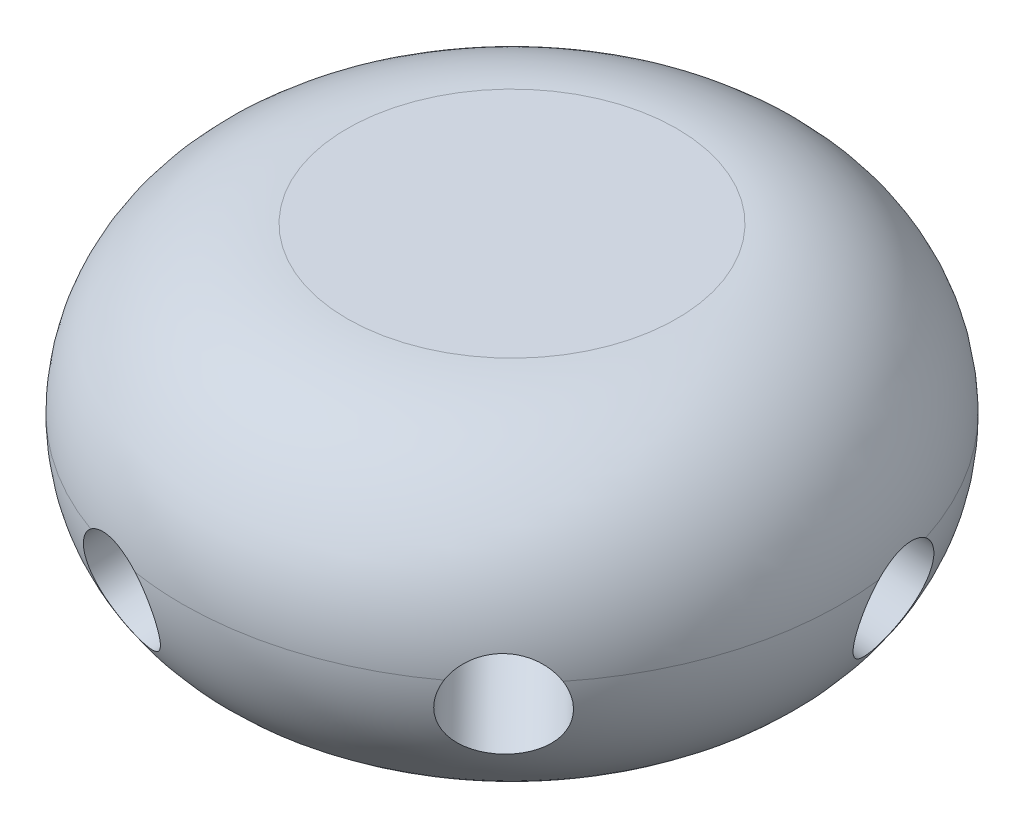
from build123d import *

# Parameters (mm, degrees)
BASE_DEPTH        = 3
BASE_DEPTH_BACK   = 7
SKETCH1_R         = 10
SKETCH2_R         = 1.5
HOLE1_DEPTH       = 19.934353276
HOLE1MIRROR_COUNT = 2
SKETCH3_R         = 1.5
HOLE2_DEPTH       = 19.445737601
HOLE2MIRROR_COUNT = 2
SKETCH4_R         = 1.5
HOLE3_DEPTH       = 19.389503466
HOLE3MIRROR_COUNT = 2
FILLET1_R         = 5


with BuildPart() as part:
    # Sketch1 → base (new, two sides: drawn at the far end of the back side and taken through both)
    with BuildSketch(Plane(origin=(0, 0, 0), x_dir=(1, 0, 0), z_dir=(0, 1, 0)).offset(-BASE_DEPTH_BACK)):
        with Locations(Location((0, 0, 0), (0, 0, 270))):
            Circle(SKETCH1_R)
    extrude(amount=BASE_DEPTH + BASE_DEPTH_BACK)

    # Sketch2 → hole1 (cut, through all)
    with BuildSketch(Plane(origin=(2.670502563, -1.093066116, 2.770130417), x_dir=(-0.6558691872850446, 0.22429081675253856, 0.7207837669443827), z_dir=(-0.6676256406563905, 0.27326652891267483, -0.692532604369038))):
        with Locations(Location((0, 0, 0), (0, 0, 346.516491398))):
            Circle(SKETCH2_R)
    hole1 = extrude(amount=-HOLE1_DEPTH, mode=Mode.SUBTRACT)

    # hole1mirror: hole1 ×2 about axis
    hole1mirror_axis = Axis((0, 5.5, 0), (0, -1, 0))
    for i in range(1, HOLE1MIRROR_COUNT):
        add(hole1.rotate(hole1mirror_axis, i * 360 / HOLE1MIRROR_COUNT), mode=Mode.SUBTRACT)

    # Sketch3 → hole2 (cut, through all)
    with BuildSketch(Plane(origin=(-0.941672921, -1.236067977, 3.685836142), x_dir=(-0.9718935871364875, 0.07382318789513377, -0.22354639834264944), z_dir=(0.23541823021467095, 0.3090169943749464, -0.921459035481267))):
        with Locations(Location((0, 0, 0), (0, 0, 90.062171088))):
            Circle(SKETCH3_R)
    hole2 = extrude(amount=-HOLE2_DEPTH, mode=Mode.SUBTRACT)

    # hole2mirror: hole2 ×2 about axis
    hole2mirror_axis = Axis((0, 5.5, 0), (0, -1, 0))
    for i in range(1, HOLE2MIRROR_COUNT):
        add(hole2.rotate(hole2mirror_axis, i * 360 / HOLE2MIRROR_COUNT), mode=Mode.SUBTRACT)

    # Sketch4 → hole3 (cut, through all)
    with BuildSketch(Plane(origin=(-3.717841, -1.236067977, 0.806098168), x_dir=(-0.19123247894507908, -0.06357892752956036, -0.979483465389136), z_dir=(0.9294602499075393, 0.30901699437494623, -0.20152454200243008))):
        with Locations(Location((0, 0, 0), (0, 0, 90))):
            Circle(SKETCH4_R)
    hole3 = extrude(amount=-HOLE3_DEPTH, mode=Mode.SUBTRACT)

    # hole3mirror: hole3 ×2 about axis
    hole3mirror_axis = Axis((0, 5.5, 0), (0, -1, 0))
    for i in range(1, HOLE3MIRROR_COUNT):
        add(hole3.rotate(hole3mirror_axis, i * 360 / HOLE3MIRROR_COUNT), mode=Mode.SUBTRACT)

    # Fillet1
    # the kernel refuses this fillet: 5 mm, written as the material it takes off along each edge
    with BuildSketch(Plane(origin=(0, -7, 0), x_dir=(0, 0, 1), z_dir=(-1, 0, 0))) as fillet1_piece_1:
        with BuildLine():
            CenterArc((10 - FILLET1_R, FILLET1_R), FILLET1_R, 270, 90)
            Line((10 - FILLET1_R, 0), (10, 0))
            Line((10, 0), (10, FILLET1_R))
        make_face()
    revolve(axis=Axis((0, -7, 0), (0, 1, 0)), mode=Mode.SUBTRACT)
    with BuildSketch(Plane(origin=(0, 3, 0), x_dir=(0, 0, 1), z_dir=(-1, 0, 0))) as fillet1_piece_2:
        with BuildLine():
            CenterArc((10 - FILLET1_R, -FILLET1_R), FILLET1_R, 0, 90)
            Line((10 - FILLET1_R, 0), (10, 0))
            Line((10, 0), (10, -FILLET1_R))
        make_face()
    revolve(axis=Axis((0, 3, 0), (0, 1, 0)), mode=Mode.SUBTRACT)


solid = part.part
